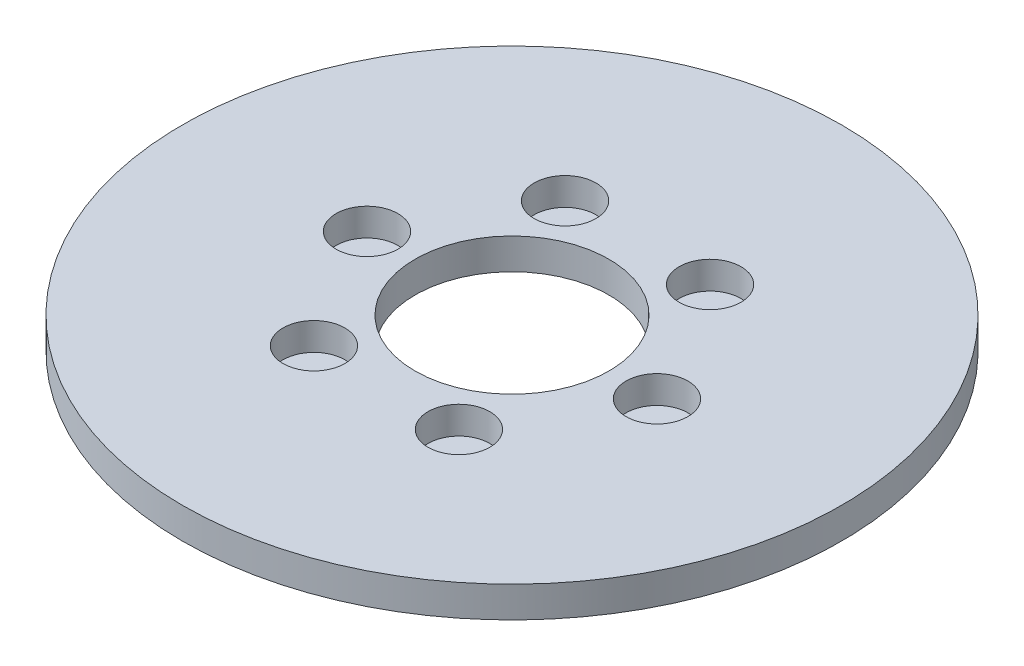
from build123d import *

# Parameters (mm, degrees)
SKETCH1_R           = 85
BOSS_EXTRUDE1_DEPTH = 8
SKETCH2_R           = 25
CUT_EXTRUDE1_DEPTH  = 121.474063599
SKETCH3_R           = 7.969174945
CUT_EXTRUDE2_DEPTH  = 7.117755521
CIRPATTERN1_COUNT   = 6


with BuildPart() as part:
    # Sketch1 → Boss-Extrude1 (new body)
    with BuildSketch(Plane(origin=(0, 0, 0), x_dir=(1, 0, 0), z_dir=(0, 1, 0))):
        Circle(SKETCH1_R)
    extrude(amount=BOSS_EXTRUDE1_DEPTH)

    # Sketch2 → Cut-Extrude1 (cut, through all)
    with BuildSketch(Plane(origin=(0, 0, 0), x_dir=(1, 0, 0), z_dir=(0, 1, 0))):
        Circle(SKETCH2_R)
    extrude(amount=CUT_EXTRUDE1_DEPTH, mode=Mode.SUBTRACT)

    # Sketch3 → Cut-Extrude2 (cut)
    with BuildSketch(Plane(origin=(0, 8, 0), x_dir=(1, 0, 0), z_dir=(0, 1, 0))):
        with Locations((-37.395280616, 0)):
            Circle(SKETCH3_R)
    cut_extrude2 = extrude(amount=-CUT_EXTRUDE2_DEPTH, mode=Mode.SUBTRACT)

    # CirPattern1: Cut-Extrude2 ×6 about axis
    cirpattern1_axis = Axis((0, 0, 0), (0, 1, 0))
    for i in range(1, CIRPATTERN1_COUNT):
        add(cut_extrude2.rotate(cirpattern1_axis, i * 360 / CIRPATTERN1_COUNT), mode=Mode.SUBTRACT)


solid = part.part
